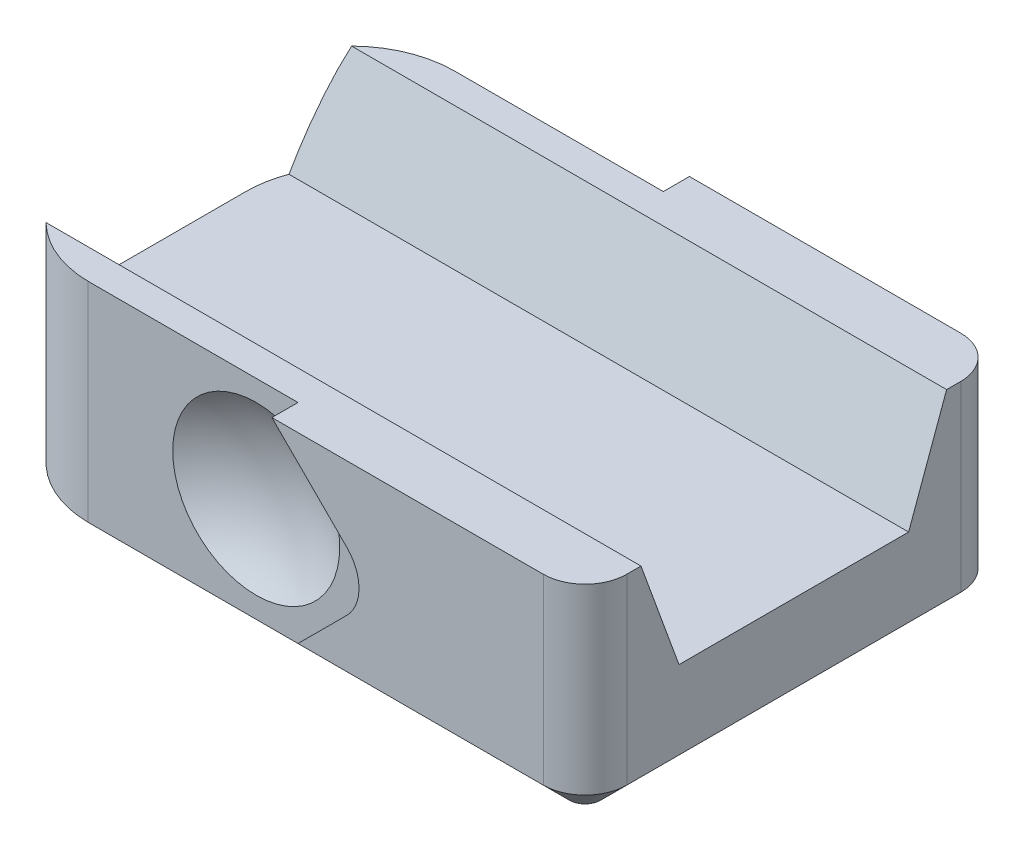
from build123d import *

# Parameters (mm, degrees)
BOSS_EXTRUDE1_DEPTH = 12.7
SKETCH2_W           = 19.05
SKETCH2_H           = 6.35
CUT_EXTRUDE1_DEPTH  = 43.121134838
CHAMFER1_START      = -18.648360593
CHAMFER1_DEPTH      = 37.698360593
CHAMFER1_START_2    = 6.35
CHAMFER1_2_DEPTH    = 7.65
CUT_EXTRUDE3_DEPTH  = 1.5875
CHAMFER3_SIZE       = 1.5875


with BuildPart() as part:
    # Sketch1 → Boss-Extrude1 (new body)
    with BuildSketch(Plane(origin=(0, 0, 0), x_dir=(1, 0, 0), z_dir=(0, 1, 0))):
        with BuildLine():
            Line((-11.189157294, -12.7), (16.51, -12.7))
            ThreePointArc((16.51, -12.7), (18.306051224, -11.956051224), (19.05, -10.16))
            Line((19.05, -10.16), (19.05, 10.16))
            ThreePointArc((19.05, 10.16), (18.306051224, 11.956051224), (16.51, 12.7))
            Line((16.51, 12.7), (-11.189157294, 12.7))
            Line((-11.189157294, 12.7), (-12.777125687, 11.112031607))
            ThreePointArc((-12.777125687, 11.112031607), (-17.21731381, 9.225276708), (-19.05, 4.7625))
            Line((-19.05, 4.7625), (-19.05, -4.7625))
            ThreePointArc((-19.05, -4.7625), (-17.21731381, -9.225276708), (-12.777125687, -11.112031607))
            Line((-12.777125687, -11.112031607), (-11.189157294, -12.7))
        make_face()
    extrude(amount=BOSS_EXTRUDE1_DEPTH)

    # Sketch2 → Cut-Extrude1 (cut, through all)
    with BuildSketch(Plane.ZY.offset(19.05)):
        with Locations((0, 9.525)):
            Rectangle(SKETCH2_W, SKETCH2_H)
    extrude(amount=-CUT_EXTRUDE1_DEPTH, mode=Mode.SUBTRACT)

    # Chamfer1: read off the stored shape, not the designer's step
    # Chamfer1 outline → Chamfer1 (add)
    with BuildSketch(Plane.YZ.offset(CHAMFER1_START)):
        Polygon((6.35, 9.525), (6.35, 6.985), (12.7, 9.296210988), (12.7, 9.525), align=None)
        Polygon((12.7, -9.296210988), (6.35, -6.985), (6.35, -9.525), (12.7, -9.525), align=None)
    extrude(amount=CHAMFER1_DEPTH)

    # Chamfer1 2 outline → Chamfer1 2 (cut)
    with BuildSketch(Plane(origin=(0, 0, 0), x_dir=(1, 0, 0), z_dir=(0, 1, 0)).offset(CHAMFER1_START_2)):
        with BuildLine():
            Line((-18.648360593, -9.525), (-16.900130206, -9.525))
            ThreePointArc((-16.900130206, -9.525), (-17.930761549, -8.362726885), (-18.648360594, -6.985))
            Line((-18.648360594, -6.985), (-18.648360593, -9.525))
        make_face()
        with BuildLine():
            Line((-18.648360593, 9.525), (-18.648360594, 6.985))
            ThreePointArc((-18.648360594, 6.985), (-17.930761549, 8.362726885), (-16.900130206, 9.525))
            Line((-16.900130206, 9.525), (-18.648360593, 9.525))
        make_face()
    extrude(amount=CHAMFER1_2_DEPTH, mode=Mode.SUBTRACT)

    # Sketch4 → Cut-Extrude3 (cut)
    with BuildSketch(Plane.XY.offset(12.7)):
        with BuildLine():
            Line((-19.05, 0), (0, 0))
            Line((0, 0), (4.553948776, 4.553948776))
            ThreePointArc((4.553948776, 4.553948776), (5.297897552, 6.35), (4.553948776, 8.146051224))
            Line((4.553948776, 8.146051224), (0, 12.7))
            Line((0, 12.7), (-19.05, 12.7))
            Line((-19.05, 12.7), (-19.05, 0))
        make_face()
    cut_extrude3 = extrude(amount=-CUT_EXTRUDE3_DEPTH, mode=Mode.SUBTRACT)

    # Sketch6 → Cut-Revolve1 (revolve, cut)
    with BuildSketch(Plane.ZY.offset(2.54)):
        with BuildLine():
            Line((11.1125, 6.35), (11.1125, 11.43))
            ThreePointArc((11.1125, 11.43), (9.931118256, 9.01113492), (9.525, 6.35))
            Line((9.525, 6.35), (11.1125, 6.35))
        make_face()
    cut_revolve1 = revolve(axis=Axis((-2.54, 6.35, 0), (0, 0, 1)), mode=Mode.SUBTRACT)

    # Mirror1: Cut-Extrude3, Cut-Revolve1 across plane
    add(cut_extrude3.mirror(Plane(origin=(0, 0, 0), x_dir=(1, 0, 0), z_dir=(0, 0, -1))), mode=Mode.SUBTRACT)
    add(cut_revolve1.mirror(Plane(origin=(0, 0, 0), x_dir=(1, 0, 0), z_dir=(0, 0, -1))), mode=Mode.SUBTRACT)

    # Chamfer3
    chamfer3_edges = [part.edges().sort_by_distance(p)[0] for p in [
        (8.255, 0, 12.7),
        (18.306051224, 0, 11.956051224),
        (19.05, 0, 0),
        (18.306051224, 0, -11.956051224),
        (8.255, 0, -12.7),
    ]]
    chamfer(chamfer3_edges, length=CHAMFER3_SIZE)


solid = part.part
